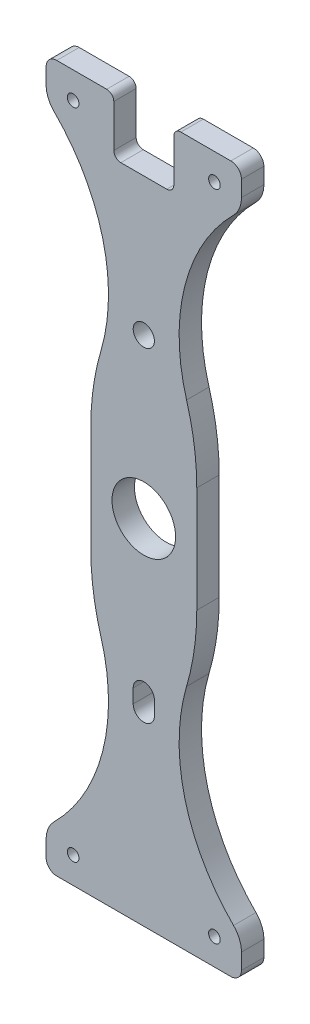
from build123d import *

# Parameters (mm, degrees)
SKETCH1_R           = 9
SKETCH1_R_2         = 3
SKETCH1_R_3         = 1.65
BOSS_EXTRUDE1_DEPTH = 6.35
CUT_EXTRUDE1_DEPTH  = 10
FILLET1_R           = 2


with BuildPart() as part:
    # Sketch1 → Boss-Extrude1 (new body)
    with BuildSketch(Plane.XY):
        with BuildLine():
            Line((-15, 15), (-15, -15))
            ThreePointArc((-15, -15), (-14.275727836, -25.159324804), (-12.117561222, -35.113156605))
            ThreePointArc((-12.117561222, -35.113156605), (-11.640196728, -62.923473964), (-25.409366876, -87.090633124))
            ThreePointArc((-25.409366876, -87.090633124), (-27.067678424, -89.572471742), (-27.65, -92.5))
            Line((-27.65, -92.5), (-27.65, -97))
            ThreePointArc((-27.65, -97), (-26.771320344, -99.121320344), (-24.65, -100))
            Line((-24.65, -100), (24.65, -100))
            ThreePointArc((24.65, -100), (26.771320344, -99.121320344), (27.65, -97))
            Line((27.65, -97), (27.65, -92.5))
            ThreePointArc((27.65, -92.5), (27.067678424, -89.572471742), (25.409366876, -87.090633124))
            ThreePointArc((25.409366876, -87.090633124), (11.640196728, -62.923473964), (12.117561222, -35.113156605))
            ThreePointArc((12.117561222, -35.113156605), (14.275727836, -25.159324804), (15, -15))
            Line((15, -15), (15, 15))
            ThreePointArc((15, 15), (14.275727836, 25.159324804), (12.117561222, 35.113156605))
            ThreePointArc((12.117561222, 35.113156605), (11.640196728, 62.923473964), (25.409366876, 87.090633124))
            ThreePointArc((25.409366876, 87.090633124), (27.067678424, 89.572471742), (27.65, 92.5))
            Line((27.65, 92.5), (27.65, 97))
            ThreePointArc((27.65, 97), (26.771320344, 99.121320344), (24.65, 100))
            Line((24.65, 100), (-24.65, 100))
            ThreePointArc((-24.65, 100), (-26.771320344, 99.121320344), (-27.65, 97))
            Line((-27.65, 97), (-27.65, 92.5))
            ThreePointArc((-27.65, 92.5), (-27.067678424, 89.572471742), (-25.409366876, 87.090633124))
            ThreePointArc((-25.409366876, 87.090633124), (-11.640196728, 62.923473964), (-12.117561222, 35.113156605))
            ThreePointArc((-12.117561222, 35.113156605), (-14.275727836, 25.159324804), (-15, 15))
        make_face()
        Circle(SKETCH1_R, mode=Mode.SUBTRACT)
        with Locations((0, 44.9961)):
            Circle(SKETCH1_R_2, mode=Mode.SUBTRACT)
        with Locations((20, 92.5)):
            Circle(SKETCH1_R_3, mode=Mode.SUBTRACT)
        with Locations((-20, 92.5)):
            Circle(SKETCH1_R_3, mode=Mode.SUBTRACT)
        with Locations((-20, -92.5)):
            Circle(SKETCH1_R_3, mode=Mode.SUBTRACT)
        with Locations((20, -92.5)):
            Circle(SKETCH1_R_3, mode=Mode.SUBTRACT)
        with BuildLine():
            Line((3, -43.0351625), (3, -46.9570375))
            ThreePointArc((3, -46.9570375), (0, -49.9570375), (-3, -46.9570375))
            Line((-3, -46.9570375), (-3, -43.0351625))
            ThreePointArc((-3, -43.0351625), (0, -40.0351625), (3, -43.0351625))
        make_face(mode=Mode.SUBTRACT)
    extrude(amount=BOSS_EXTRUDE1_DEPTH)

    # Sketch3 → Cut-Extrude1 (cut)
    with BuildSketch(Plane.XY.offset(6.35)):
        with BuildLine():
            Line((-8.5, 101), (-8.5, 86))
            ThreePointArc((-8.5, 86), (-7.914213562, 84.585786438), (-6.5, 84))
            Line((-6.5, 84), (6.5, 84))
            ThreePointArc((6.5, 84), (7.914213562, 84.585786438), (8.5, 86))
            Line((8.5, 86), (8.5, 101))
            Line((8.5, 101), (-8.5, 101))
        make_face()
    extrude(amount=-CUT_EXTRUDE1_DEPTH, mode=Mode.SUBTRACT)

    # Fillet1
    fillet1_edges = [part.edges().sort_by_distance(p)[0] for p in [
        (8.5, 100, 3.175),
        (-8.5, 100, 3.175),
    ]]
    fillet(fillet1_edges, radius=FILLET1_R)


solid = part.part
